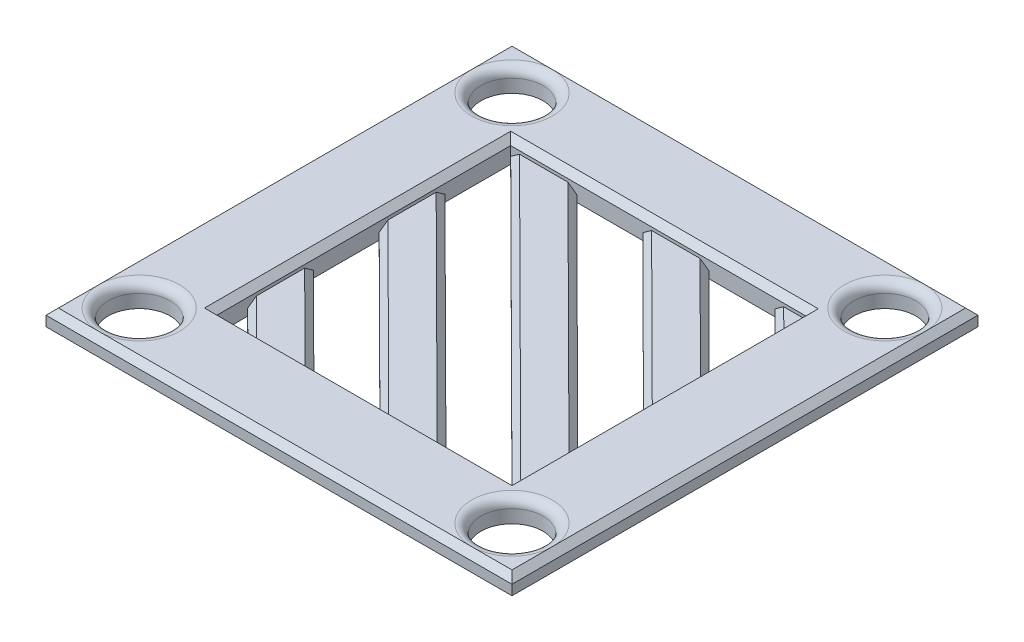
from build123d import *

# Parameters (mm, degrees)
SKETCH1_R           = 25.4
BOSS_EXTRUDE2_DEPTH = 18.356350904
CUT_EXTRUDE1_DEPTH  = 7.62
FILLET1_R           = 7.62
CHAMFER1_SIZE       = 5.08
CHAMFER2_SIZE       = 5.08
CHAMFER3_SIZE       = 5.08
CHAMFER4_SIZE       = 5.08
CHAMFER8_SIZE       = 5.08


with BuildPart() as part:
    # Sketch1 → Boss-Extrude2 (new body)
    with BuildSketch(Plane(origin=(0, 0, 0), x_dir=(1, 0, 0), z_dir=(0, 1, 0))):
        Polygon((-342.9, 381), (-381, 381), (-381, 0), (-342.9, 0), (-38.1, 0), (0, 0), (0, 381), (-38.1, 381), align=None)
        with Locations(Location((-342.9, 38.1, 0), (0, 0, 270))):
            Circle(SKETCH1_R, mode=Mode.SUBTRACT)
        Polygon((-285.853349775, 69.85), (-311.15, 69.85), (-311.15, 95.035246339), align=None, mode=Mode.SUBTRACT)
        Polygon((-311.15, 148.798269562), (-311.15, 190.5), (-311.15, 202.561292784), (-177.851674887, 69.85), (-231.852512331, 69.85), align=None, mode=Mode.SUBTRACT)
        with Locations(Location((-38.1, 38.1, 0), (0, 0, 270))):
            Circle(SKETCH1_R, mode=Mode.SUBTRACT)
        Polygon((-311.15, 256.324316007), (-311.15, 310.08733923), (-69.85, 69.85), (-123.850837444, 69.85), align=None, mode=Mode.SUBTRACT)
        with Locations(Location((-342.9, 342.9, 0), (0, 0, 270))):
            Circle(SKETCH1_R, mode=Mode.SUBTRACT)
        Polygon((-69.85, 177.376046445), (-69.85, 123.613023223), (-257.149162556, 310.08733923), (-203.148325113, 310.08733923), align=None, mode=Mode.SUBTRACT)
        Polygon((-149.147487669, 310.08733923), (-95.146650225, 310.08733923), (-69.85, 284.902092891), (-69.85, 231.139069668), align=None, mode=Mode.SUBTRACT)
        with Locations(Location((-38.1, 342.9, 0), (0, 0, 270))):
            Circle(SKETCH1_R, mode=Mode.SUBTRACT)
    extrude(amount=BOSS_EXTRUDE2_DEPTH)

    # Sketch3 → Cut-Extrude1 (cut)
    with BuildSketch(Plane(origin=(0, 18.356350904, 0), x_dir=(1, 0, 0), z_dir=(0, 1, 0))):
        Polygon((-69.85, 177.376046445), (-69.85, 310.08733923), (-311.15, 310.08733923), (-311.15, 69.85), (-69.85, 69.85), align=None)
    extrude(amount=-CUT_EXTRUDE1_DEPTH, mode=Mode.SUBTRACT)

    # Fillet1
    fillet1_edges = [part.edges().sort_by_distance(p)[0] for p in [
        (-38.1, 18.356350904, -63.5),
        (-38.1, 18.356350904, -368.3),
        (-342.9, 18.356350904, -63.5),
        (-342.9, 18.356350904, -368.3),
    ]]
    fillet(fillet1_edges, radius=FILLET1_R)

    # Chamfer1
    chamfer1_edges = [part.edges().sort_by_distance(p)[0] for p in [
        (-69.85, 18.356350904, -189.968669615),
        (-190.5, 18.356350904, -310.08733923),
        (-190.5, 18.356350904, -69.85),
        (-311.15, 18.356350904, -189.968669615),
    ]]
    chamfer(chamfer1_edges, length=CHAMFER1_SIZE)

    # Chamfer2
    chamfer2_edges = [part.edges().sort_by_distance(p)[0] for p in [
        (-298.501674887, 10.736350904, -82.442623169),
        (-271.501256165, 10.736350904, -109.324134781),
        (-244.500837444, 10.736350904, -136.205646392),
        (-217.500418722, 10.736350904, -163.087158004),
        (-136.499162556, 10.736350904, -243.731692838),
        (-109.498743835, 10.736350904, -270.613204449),
        (-190.5, 10.736350904, -189.968669615),
        (-163.499581278, 10.736350904, -216.850181226),
        (-82.498325113, 10.736350904, -297.49471606),
    ]]
    chamfer(chamfer2_edges, length=CHAMFER2_SIZE)

    # Chamfer3
    chamfer3_edges = [part.edges().sort_by_distance(p)[0] for p in [
        (-381, 18.356350904, -190.5),
        (-190.5, 18.356350904, 0),
        (0, 18.356350904, -190.5),
        (-190.5, 18.356350904, -381),
    ]]
    chamfer(chamfer3_edges, length=CHAMFER3_SIZE - 0.0001)  # a hair under: the kernel refuses the full size

    # Chamfer4
    chamfer4_edges = [part.edges().sort_by_distance(p)[0] for p in [
        (-190.5, 0, -381),
        (0, 0, -190.5),
        (-190.5, 0, 0),
        (-381, 0, -190.5),
    ]]
    chamfer(chamfer4_edges, length=CHAMFER4_SIZE)

    # Chamfer8
    chamfer8_edges = [part.edges().sort_by_distance(p)[0] for p in [
        (-136.499162556, 0, -243.731692838),
        (-109.498743835, 0, -270.613204449),
    ]]
    chamfer(chamfer8_edges, length=CHAMFER8_SIZE)


solid = part.part
